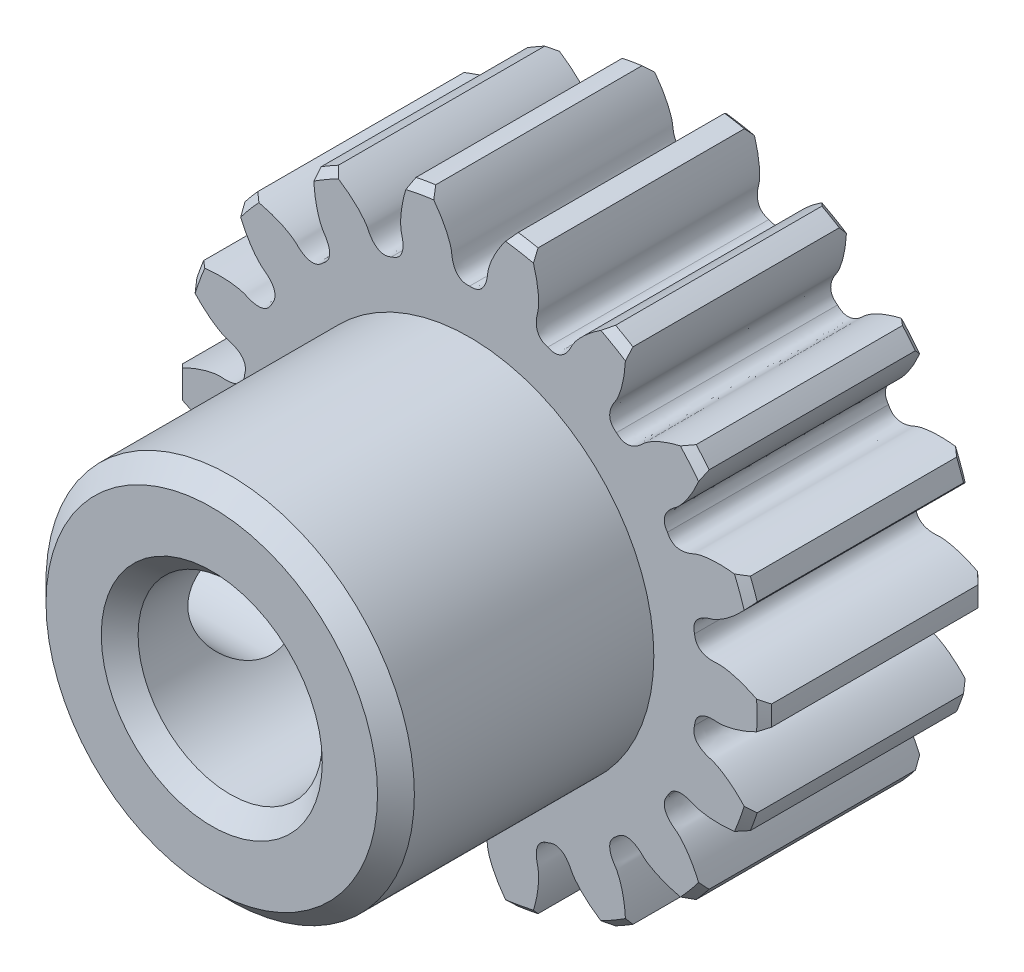
from build123d import *

# Parameters (mm, degrees)
GEAR_BASESKETCH_R                            = 8
F_0_8_MODULE_14_4000MM_P_D_DEPTH             = 3
TOOTH_CUT_COARSE_PITCH_INVOLUTE_20_DEG_DEPTH = 12.704699911
CHAMFER_703_SIZE                             = 0.2
TOOTH_PATTERN_18_18_COUNT                    = 18
SKETCH3_R                                    = 5
SKETCH3_R_2                                  = 2.5
EXTRUDE_1090_DEPTH                           = 7
SKETCH4_R                                    = 5
CUT_EXTRUDE_1361_DEPTH                       = 3
CUT_EXTRUDE_START                            = -3
SKETCH5_R                                    = 2.5
CUT_EXTRUDE_1604_DEPTH                       = 3
CHAMFER_1991_SIZE                            = 0.5
SKETCH6_R                                    = 1.65
CUT_EXTRUDE_2178_DEPTH                       = 4


with BuildPart() as part:
    # Gear-BaseSketch → 0.8 Module, 14,4000mm P.D. (new, symmetric)
    with BuildSketch(Plane.XY):
        Circle(GEAR_BASESKETCH_R)
    extrude(amount=F_0_8_MODULE_14_4000MM_P_D_DEPTH, both=True)

    # Tooth-Sketch; Backlash: 0,0000mm → Tooth-Cut, Coarse Pitch Involute 20 deg (cut, symmetric)
    with BuildSketch(Plane.XY):
        with BuildLine():
            ThreePointArc((-1.188717893, 8.000402693), (0, 8.08823179), (1.188717893, 8.000402693))
            add(Edge.make_bspline(
                [(1.188717893, 8.000402693), (1.108648495, 7.910450075), (0.998051204, 7.775624837), (0.868218399, 7.593430674), (0.787430611, 7.468912514), (0.718690931, 7.352116281), (0.661158946, 7.243835289), (0.61394864, 7.144803658), (0.5761317, 7.055693938), (0.546743771, 6.977114679), (0.524780351, 6.909609135), (0.509223911, 6.853651433), (0.498984499, 6.809650608), (0.493066583, 6.777934881), (0.490211937, 6.7587825), (0.488695415, 6.743519506), (0.486805922, 6.719579905), (0.482887828, 6.68328409), (0.474494991, 6.626197091), (0.460215171, 6.558499473), (0.436128003, 6.481824546), (0.404160225, 6.41014801), (0.361738483, 6.3426302), (0.304204321, 6.279928162), (0.190373189, 6.202235676), (0.075511388, 6.193069225), (0, 6.199445465)],
                knots=[0, 0, 0, 0, 0.157961946, 0.228480673, 0.293357902, 0.352593633, 0.406187867, 0.454140604, 0.496451843, 0.533121585, 0.56414983, 0.589536579, 0.609281832, 0.623385592, 0.631847864, 0.634668687, 0.643502696, 0.663346333, 0.682538951, 0.719174427, 0.753969949, 0.787768004, 0.82185533, 0.858103523, 0.898741151, 1, 1, 1, 1], degree=3))
            add(Edge.make_bspline(
                [(-1.188717893, 8.000402693), (-1.108648495, 7.910450075), (-0.998051204, 7.775624837), (-0.868218399, 7.593430674), (-0.787430611, 7.468912514), (-0.718690931, 7.352116281), (-0.661158946, 7.243835289), (-0.61394864, 7.144803658), (-0.5761317, 7.055693938), (-0.546743771, 6.977114679), (-0.524780351, 6.909609135), (-0.509223911, 6.853651433), (-0.498984499, 6.809650608), (-0.493066583, 6.777934881), (-0.490211937, 6.7587825), (-0.488695415, 6.743519506), (-0.486805922, 6.719579905), (-0.482887828, 6.68328409), (-0.474494991, 6.626197091), (-0.460215171, 6.558499473), (-0.436128003, 6.481824546), (-0.404160225, 6.41014801), (-0.361738483, 6.3426302), (-0.304204321, 6.279928162), (-0.190373189, 6.202235676), (-0.075511388, 6.193069225), (0, 6.199445465)],
                knots=[0, 0, 0, 0, 0.157961946, 0.228480673, 0.293357902, 0.352593633, 0.406187867, 0.454140604, 0.496451843, 0.533121585, 0.56414983, 0.589536579, 0.609281832, 0.623385592, 0.631847864, 0.634668687, 0.643502696, 0.663346333, 0.682538951, 0.719174427, 0.753969949, 0.787768004, 0.82185533, 0.858103523, 0.898741151, 1, 1, 1, 1], degree=3))
        make_face()
    tooth_cut_coarse_pitch_involute_20_deg = extrude(amount=TOOTH_CUT_COARSE_PITCH_INVOLUTE_20_DEG_DEPTH, both=True, mode=Mode.SUBTRACT)

    # Chamfer 703
    chamfer_703_edges = [part.edges().sort_by_distance(p)[0] for p in [
        (0, -8, -3),
        (0, -8, 3),
    ]]
    chamfer(chamfer_703_edges, length=CHAMFER_703_SIZE)

    # Tooth Pattern, 18 / 18: Tooth-Cut, Coarse Pitch Involute 20 deg ×18 about axis
    tooth_pattern_18_18_axis = Axis((0, 0, -4.277017338), (0, 0, 1))
    for i in range(1, TOOTH_PATTERN_18_18_COUNT):
        add(tooth_cut_coarse_pitch_involute_20_deg.rotate(tooth_pattern_18_18_axis, i * 360 / TOOTH_PATTERN_18_18_COUNT), mode=Mode.SUBTRACT)

    # Sketch3 → Extrude 1090 (add)
    with BuildSketch(Plane.XY.offset(3)):
        Circle(SKETCH3_R)
        Circle(SKETCH3_R_2, mode=Mode.SUBTRACT)
    extrude(amount=EXTRUDE_1090_DEPTH)

    # Sketch4 → Cut-Extrude 1361 (cut)
    with BuildSketch(Plane(origin=(0, 0, -3), x_dir=(-1, 0, 0), z_dir=(0, 0, -1))):
        Circle(SKETCH4_R)
    extrude(amount=-CUT_EXTRUDE_1361_DEPTH, mode=Mode.SUBTRACT)

    # Sketch5 → Cut-Extrude 1604 (cut)
    with BuildSketch(Plane.XY.offset(3).offset(CUT_EXTRUDE_START)):
        Circle(SKETCH5_R)
    extrude(amount=CUT_EXTRUDE_1604_DEPTH, mode=Mode.SUBTRACT)

    # Chamfer 1991
    chamfer_1991_edges = [part.edges().sort_by_distance(p)[0] for p in [
        (-5, 0, 10),
        (-2.5, 0, 10),
        (5, 0, -3),
        (-2.5, 0, 0),
    ]]
    chamfer(chamfer_1991_edges, length=CHAMFER_1991_SIZE)

    # Sketch6 → Cut-Extrude 2178 (cut)
    with BuildSketch(Plane.ZY.offset(5)):
        with Locations((6.5, 0)):
            Circle(SKETCH6_R)
    extrude(amount=-CUT_EXTRUDE_2178_DEPTH, mode=Mode.SUBTRACT)


solid = part.part
